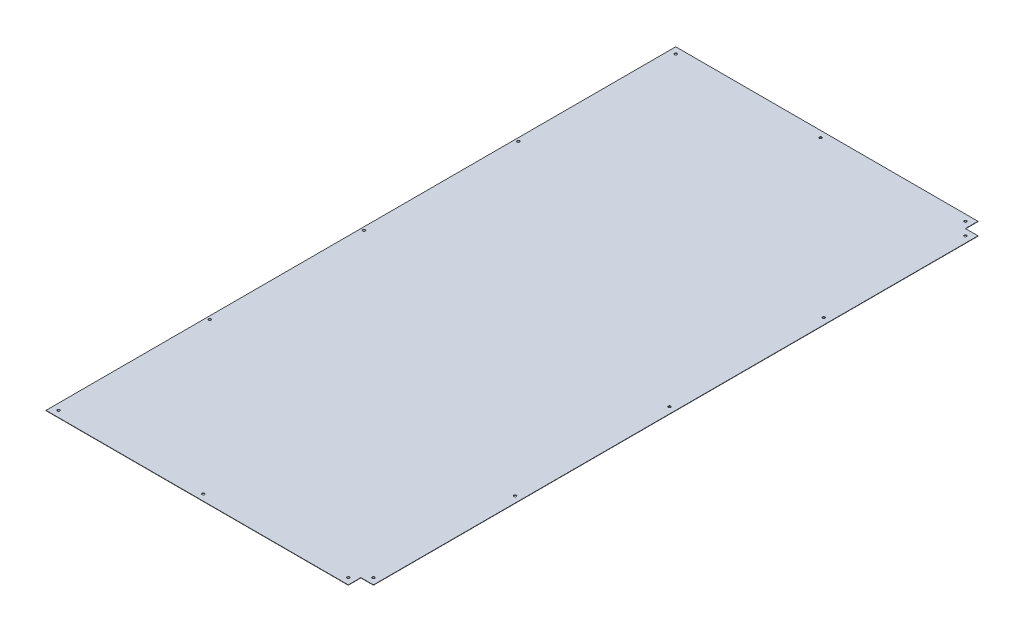
from build123d import *

# Parameters (mm, degrees)
SKETCH1_R           = 3
BOSS_EXTRUDE1_DEPTH = 1
CHAMFER1_SIZE       = 1


with BuildPart() as part:
    # Sketch1 → Boss-Extrude1 (new body)
    with BuildSketch(Plane(origin=(0, 0, 0), x_dir=(1, 0, 0), z_dir=(0, 1, 0))):
        Polygon((500, -960), (460, -960), (460, -1000), (-500, -1000), (-500, 1000), (460, 1000), (460, 960), (500, 960), align=None)
        with Locations(Location((480, 0, 0), (0, 0, 270))):
            Circle(SKETCH1_R, mode=Mode.SUBTRACT)
        with Locations(Location((-490, -490, 0), (0, 0, 270))):
            Circle(SKETCH1_R, mode=Mode.SUBTRACT)
        with Locations(Location((-490, 490, 0), (0, 0, 270))):
            Circle(SKETCH1_R, mode=Mode.SUBTRACT)
        with Locations(Location((-480, 980, 0), (0, 0, 270))):
            Circle(SKETCH1_R, mode=Mode.SUBTRACT)
        with Locations(Location((-480, -980, 0), (0, 0, 270))):
            Circle(SKETCH1_R, mode=Mode.SUBTRACT)
        with Locations(Location((480, 490, 0), (0, 0, 270))):
            Circle(SKETCH1_R, mode=Mode.SUBTRACT)
        with Locations(Location((-20, -980, 0), (0, 0, 270))):
            Circle(SKETCH1_R, mode=Mode.SUBTRACT)
        with Locations(Location((-20, 980, 0), (0, 0, 270))):
            Circle(SKETCH1_R, mode=Mode.SUBTRACT)
        with Locations(Location((-490, 0, 0), (0, 0, 270))):
            Circle(SKETCH1_R, mode=Mode.SUBTRACT)
        with Locations(Location((440, -980, 0), (0, 0, 270))):
            Circle(SKETCH1_R, mode=Mode.SUBTRACT)
        with Locations(Location((480, -940, 0), (0, 0, 270))):
            Circle(SKETCH1_R, mode=Mode.SUBTRACT)
        with Locations(Location((440, 980, 0), (0, 0, 270))):
            Circle(SKETCH1_R, mode=Mode.SUBTRACT)
        with Locations(Location((480, 940, 0), (0, 0, 270))):
            Circle(SKETCH1_R, mode=Mode.SUBTRACT)
        with Locations(Location((480, -490, 0), (0, 0, 270))):
            Circle(SKETCH1_R, mode=Mode.SUBTRACT)
    extrude(amount=BOSS_EXTRUDE1_DEPTH)

    # Chamfer1
    chamfer1_edges = [part.edges().sort_by_distance(p)[0] for p in [
        (480, 1, 487),
        (480, 1, -3),
        (-490, 1, 487),
        (-490, 1, -493),
        (-480, 1, -983),
        (-480, 1, 977),
        (480, 1, -493),
        (-20, 1, 977),
        (-20, 1, -983),
        (-490, 1, -3),
        (440, 1, 977),
        (480, 1, 937),
        (440, 1, -983),
        (480, 1, -943),
    ]]
    chamfer(chamfer1_edges, length=CHAMFER1_SIZE - 0.0001)  # a hair under: the kernel refuses the full size


solid = part.part
